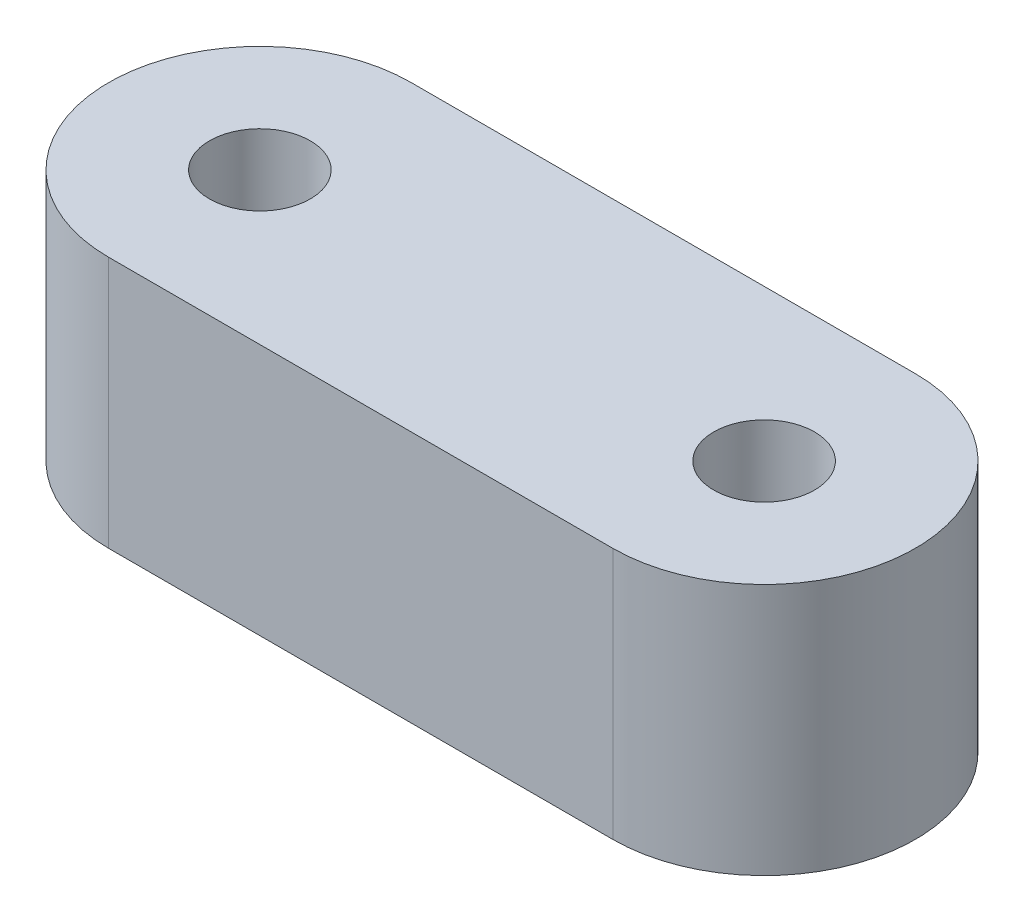
from build123d import *

# Parameters (mm, degrees)
BOSS_EXTRUDE1_DEPTH = 12.7
SKETCH4_R           = 2.54
CUT_EXTRUDE3_DEPTH  = 73.645776202


with BuildPart() as part:
    # Sketch3 → Boss-Extrude1 (new body)
    with BuildSketch(Plane(origin=(0, 0, 0), x_dir=(1, 0, 0), z_dir=(0, 1, 0))):
        with BuildLine():
            Line((-63.5, 7.62), (-38.1, 7.62))
            ThreePointArc((-38.1, 7.62), (-30.48, 0), (-38.1, -7.62))
            Line((-38.1, -7.62), (-63.5, -7.62))
            ThreePointArc((-63.5, -7.62), (-71.12, 0), (-63.5, 7.62))
        make_face()
    extrude(amount=BOSS_EXTRUDE1_DEPTH)

    # Sketch4 → Cut-Extrude3 (cut, through all)
    with BuildSketch(Plane(origin=(0, 12.7, 0), x_dir=(1, 0, 0), z_dir=(0, 1, 0))):
        with Locations((-63.5, 0)):
            Circle(SKETCH4_R)
        with Locations((-38.1, 0)):
            Circle(SKETCH4_R)
    extrude(amount=-CUT_EXTRUDE3_DEPTH, mode=Mode.SUBTRACT)


solid = part.part
